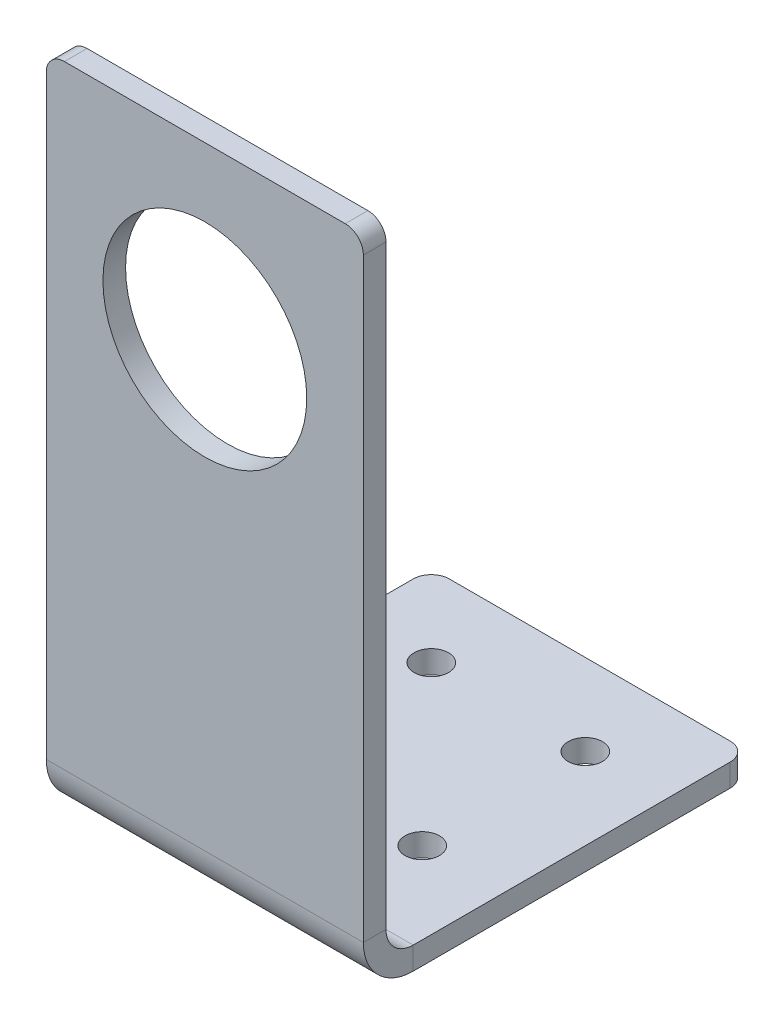
from build123d import *

# Parameters (mm, degrees)
SKETCH1_R              = 14.2875
BOSS_EXTRUDE1_DEPTH    = 3.175
SKETCH2_W              = 44.45
SKETCH2_H              = 3.175
BOSS_EXTRUDE2_DEPTH    = 50.8
FILLET1_R              = 2.54
CONVERT_SOLID1_START   = -22.225
CONVERT_SOLID1_DEPTH   = 44.45
CONVERT_SOLID1_2_DEPTH = 44.45
SKETCH7_R              = 2.413
CUT_EXTRUDE1_DEPTH     = 50.8


# Read off the part's stored shape, not the designer's step: Convert-Solid1
with BuildPart() as part:
    # Sketch1 → Boss-Extrude1 (new body)
    with BuildSketch(Plane.XY):
        with BuildLine():
            Line((-22.225, -46.491872792), (22.225, -46.491872792))
            Line((22.225, -46.491872792), (22.225, 43.951872792))
            ThreePointArc((22.225, 43.951872792), (21.481051224, 45.747924016), (19.685, 46.491872792))
            Line((19.685, 46.491872792), (-19.685, 46.491872792))
            ThreePointArc((-19.685, 46.491872792), (-21.481051224, 45.747924016), (-22.225, 43.951872792))
            Line((-22.225, 43.951872792), (-22.225, -46.491872792))
        make_face()
        with Locations((0, 22.596127208)):
            Circle(SKETCH1_R, mode=Mode.SUBTRACT)
    extrude(amount=BOSS_EXTRUDE1_DEPTH)

    # Sketch2 → Boss-Extrude2 (add)
    with BuildSketch(Plane(origin=(0, 0, 0), x_dir=(-1, 0, 0), z_dir=(0, 0, -1))):
        with Locations((0, -44.904372792)):
            Rectangle(SKETCH2_W, SKETCH2_H)
    extrude(amount=BOSS_EXTRUDE2_DEPTH)

    # Fillet1
    fillet1_edges = [part.edges().sort_by_distance(p)[0] for p in [
        (22.225, -44.904372792, -50.8),
        (-22.225, -44.904372792, -50.8),
    ]]
    fillet(fillet1_edges, radius=FILLET1_R)

    # Convert-Solid1 outline → Convert-Solid1 (cut)
    with BuildSketch(Plane.YZ.offset(CONVERT_SOLID1_START)):
        with BuildLine():
            ThreePointArc((-46.491872792, -3.81), (-44.446013659, 1.129140866), (-39.506872792, 3.175))
            Line((-39.506872792, 3.175), (-46.491872792, 3.175))
            Line((-46.491872792, 3.175), (-46.491872792, -3.81))
        make_face()
    extrude(amount=CONVERT_SOLID1_DEPTH, mode=Mode.SUBTRACT)

    # Convert-Solid1 2 outline → Convert-Solid1 2 (add)
    with BuildSketch(Plane.YZ.offset(CONVERT_SOLID1_START)):
        with BuildLine():
            ThreePointArc((-43.316872792, -3.81), (-42.200949628, -1.115923164), (-39.506872792, 0))
            Line((-39.506872792, 0), (-43.316872792, 0))
            Line((-43.316872792, 0), (-43.316872792, -3.81))
        make_face()
    extrude(amount=CONVERT_SOLID1_2_DEPTH)

    # Sketch7 → Cut-Extrude1 (cut)
    with BuildSketch(Plane(origin=(0, -43.316872792, 0), x_dir=(1, 0, 0), z_dir=(0, 1, 0))):
        with Locations(Location((-10.795, 39.37, 0), (0, 0, 180))):
            Circle(SKETCH7_R)
        with Locations(Location((10.795, 39.37, 0), (0, 0, 180))):
            Circle(SKETCH7_R)
        with Locations(Location((-10.795, 16.51, 0), (0, 0, 180))):
            Circle(SKETCH7_R)
        with Locations(Location((10.795, 16.51, 0), (0, 0, 180))):
            Circle(SKETCH7_R)
    extrude(amount=-CUT_EXTRUDE1_DEPTH, mode=Mode.SUBTRACT)


solid = part.part
